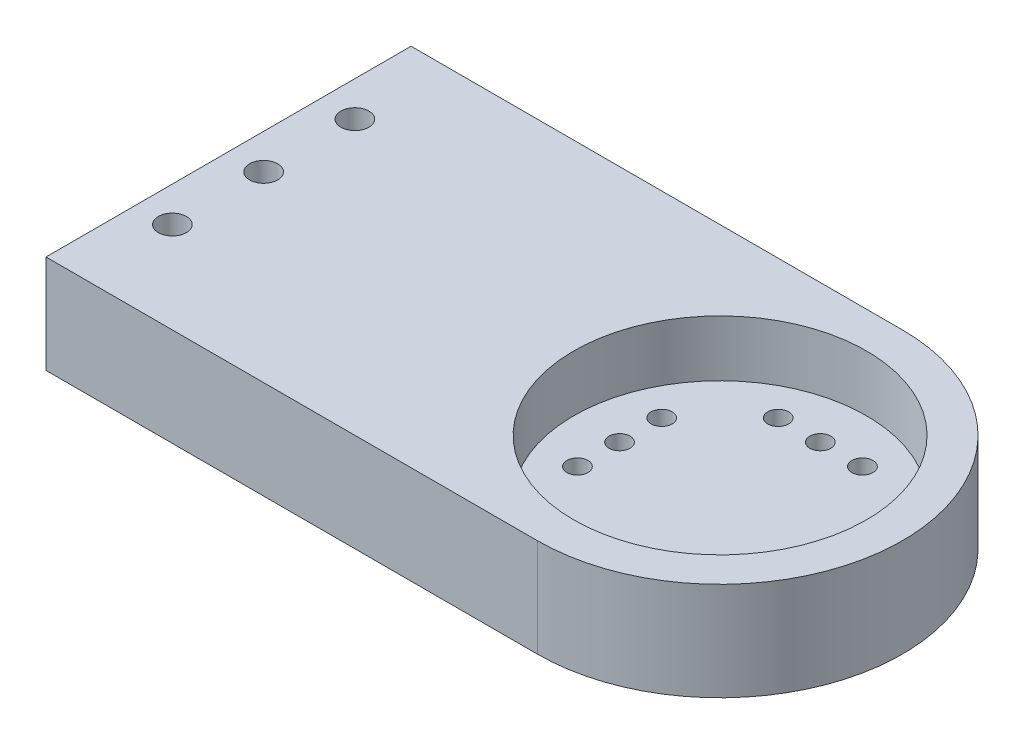
from build123d import *

# Parameters (mm, degrees)
BOSS_EXTRUDE1_DEPTH       = 7
HOLE3_START               = 3
HOLE3_OUTLINE_R           = 10.425
HOLE3_DEPTH               = 4
F_2_0MM_DOWEL_HOLE1_D     = 2
F_2_0MM_DOWEL_HOLE1_DEPTH = 7
F_2_0MM_DOWEL_HOLE1_TIP   = 0.600860619
F_1_5MM_DOWEL_HOLE1_D     = 1.5
F_1_5MM_DOWEL_HOLE1_DEPTH = 7
F_1_5MM_DOWEL_HOLE1_TIP   = 0.450645464


# Read off the part's stored shape, not the designer's step: Hole3
with BuildPart() as part:
    # Sketch1 → Boss-Extrude1 (new body)
    with BuildSketch(Plane(origin=(0, 0, 0), x_dir=(1, 0, 0), z_dir=(0, 1, 0))):
        with BuildLine():
            Line((0, 26), (0, 0))
            Line((0, 0), (35, 0))
            ThreePointArc((35, 0), (22, 13), (35, 26))
            Line((35, 26), (0, 26))
        make_face()
        with BuildLine():
            ThreePointArc((35, 26), (22, 13), (35, 0))
            Line((35, 0), (35, 26))
        make_face()
        with BuildLine():
            Line((35, 26), (35, 0))
            ThreePointArc((35, 0), (44.192388155, 3.807611845), (48, 13))
            ThreePointArc((48, 13), (44.192388155, 22.192388155), (35, 26))
        make_face()
    extrude(amount=BOSS_EXTRUDE1_DEPTH)

    # Hole3 outline → Hole3 (cut)
    with BuildSketch(Plane(origin=(0, 0, 0), x_dir=(1, 0, 0), z_dir=(0, 1, 0)).offset(HOLE3_START)):
        with Locations((35.011233351, 13.001482521)):
            Circle(HOLE3_OUTLINE_R)
    extrude(amount=HOLE3_DEPTH, mode=Mode.SUBTRACT)

    # Ø2.0mm Dowel Hole1
    with Locations(Plane(origin=(0, 0, 0), x_dir=(-1, 0, 0), z_dir=(0, -1, 0))):
        with Locations((-2.5, 6.5), (-2.5, 13), (-2.5, 19.5)):
            Hole(F_2_0MM_DOWEL_HOLE1_D / 2, depth=F_2_0MM_DOWEL_HOLE1_DEPTH)
            with Locations((0, 0, -(F_2_0MM_DOWEL_HOLE1_DEPTH + F_2_0MM_DOWEL_HOLE1_TIP / 2))):  # 118° drill point
                Cone(0, F_2_0MM_DOWEL_HOLE1_D / 2, F_2_0MM_DOWEL_HOLE1_TIP, mode=Mode.SUBTRACT)

    # Ø1.5mm Dowel Hole1
    with Locations(Plane(origin=(35, 0, -5.85), x_dir=(0, 0, -1), z_dir=(0, -1, 0))):
        with Locations((0, 0), (0, 3), (0, -3), (4.15, -7.15), (7.15, -7.15), (10.15, -7.15), (4.15, 7.15), (7.15, 7.15), (10.15, 7.15), (14.3, 0), (14.3, -3), (14.3, 3)):
            Hole(F_1_5MM_DOWEL_HOLE1_D / 2, depth=F_1_5MM_DOWEL_HOLE1_DEPTH)
            with Locations((0, 0, -(F_1_5MM_DOWEL_HOLE1_DEPTH + F_1_5MM_DOWEL_HOLE1_TIP / 2))):  # 118° drill point
                Cone(0, F_1_5MM_DOWEL_HOLE1_D / 2, F_1_5MM_DOWEL_HOLE1_TIP, mode=Mode.SUBTRACT)


solid = part.part
